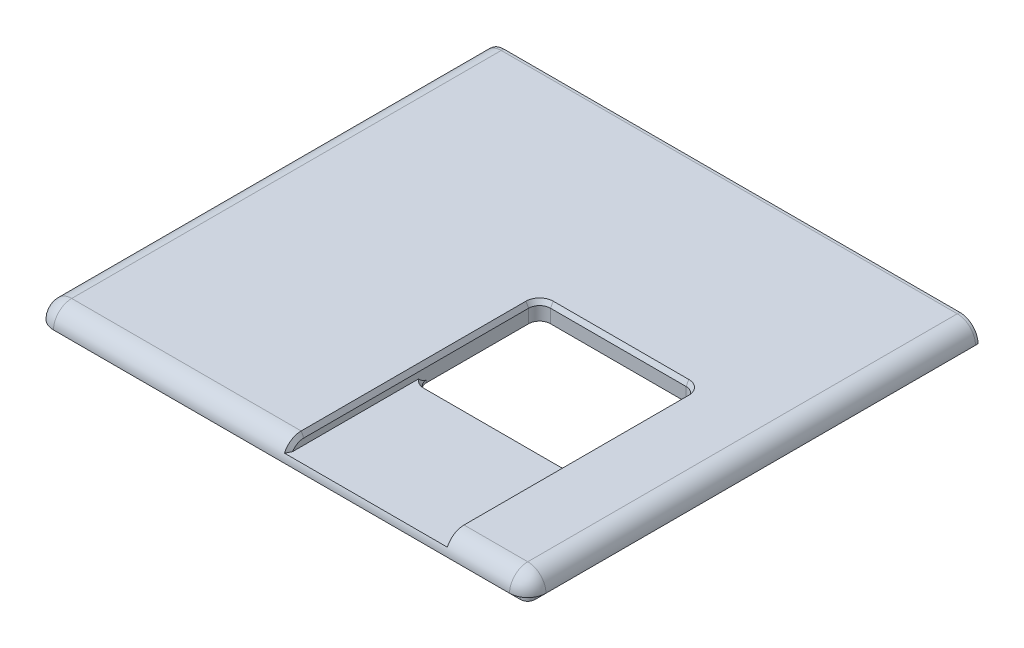
from build123d import *
from OCP.BRepFilletAPI import BRepFilletAPI_MakeChamfer

# Parameters (mm, degrees)
SKETCH1_W           = 135.29
SKETCH1_H           = 128
BOSS_EXTRUDE1_DEPTH = 5
SKETCH2_W           = 129.29
SKETCH2_H           = 122
BOSS_EXTRUDE2_DEPTH = 3
FILLET4_R           = 5
FILLET5_R           = 5
FILLET6_R           = 2
CUT_EXTRUDE1_REACH  = 95.466
SKETCH3_W           = 135.29
SKETCH3_H           = 4.25
SKETCH4_W           = 123.29
SKETCH4_H           = 117.75
CUT_EXTRUDE2_DEPTH  = 3
FILLET7_R           = 2
SKETCH5_W           = 43.25
SKETCH5_H           = 69.75
CUT_EXTRUDE3_DEPTH  = 3
SKETCH6_W           = 43.25
SKETCH6_H           = 34
CUT_EXTRUDE4_DEPTH  = 2
FILLET9_R           = 3
CHAMFER1_SIZE       = 0.75
CHAMFER1_SIZE2      = 1.299038106
CHAMFER2_SIZE       = 0.75
CHAMFER2_SIZE_2     = 1.299038106
SKETCH7_W           = 26
SKETCH7_H           = 3
CUT_EXTRUDE5_DEPTH  = 3
CHAMFER3_SIZE       = 0.75
CHAMFER3_SIZE2      = 1.299038106


# Some blends are built 0.0001 mm under size
with BuildPart() as part:
    # Sketch1 → Boss-Extrude1 (new body)
    with BuildSketch(Plane(origin=(0, 0, 0), x_dir=(1, 0, 0), z_dir=(0, 1, 0))):
        Rectangle(SKETCH1_W, SKETCH1_H)
    extrude(amount=BOSS_EXTRUDE1_DEPTH)

    # Sketch2 → Boss-Extrude2 (add)
    with BuildSketch(Plane.XZ):
        Rectangle(SKETCH2_W, SKETCH2_H)
    extrude(amount=BOSS_EXTRUDE2_DEPTH)

    # Fillet4
    fillet4_edges = [part.edges().sort_by_distance(p)[0] for p in [
        (-67.645, 2.5, -64),
        (67.645, 2.5, -64),
        (67.645, 2.5, 64),
        (-67.645, 2.5, 64),
    ]]
    fillet(fillet4_edges, radius=FILLET4_R)

    # Fillet5
    fillet5_edges = [part.edges().sort_by_distance(p)[0] for p in [
        (-66.180533906, 5, -62.535533906),
        (-67.645, 5, 0),
        (-66.180533906, 5, 62.535533906),
        (0, 5, 64),
        (66.180533906, 5, 62.535533906),
        (67.645, 5, 0),
        (66.180533906, 5, -62.535533906),
        (0, 5, -64),
    ]]
    fillet(fillet5_edges, radius=FILLET5_R - 0.0001)  # a hair under: the kernel refuses the full size

    # Fillet6
    fillet6_edges = [part.edges().sort_by_distance(p)[0] for p in [
        (-64.645, -1.5, 61),
        (-64.645, -1.5, -61),
        (64.645, -1.5, -61),
        (64.645, -1.5, 61),
    ]]
    fillet(fillet6_edges, radius=FILLET6_R)

    # Cut-Extrude1: up to this face of the body (flat: up to its plane)
    cut_extrude1_end = Plane(part.part.faces().sort_by_distance((0, -3, 0))[0])
    # Sketch3 → Cut-Extrude1 (cut, up to the picked face)
    with BuildSketch(Plane(origin=(0, 5, 0), x_dir=(1, 0, 0), z_dir=(0, 1, 0)), mode=Mode.PRIVATE) as cut_extrude1_sk1:
        with Locations((0, 61.875)):
            Rectangle(SKETCH3_W, SKETCH3_H)
    cut_extrude1_tool1 = split(extrude(cut_extrude1_sk1.sketch, amount=-CUT_EXTRUDE1_REACH, mode=Mode.PRIVATE), bisect_by=cut_extrude1_end, keep=Keep.BOTH, mode=Mode.PRIVATE)
    add(cut_extrude1_tool1.solids().sort_by(Axis((0, 5, -61.875), (0, -1, 0)))[0], mode=Mode.SUBTRACT)

    # Sketch4 → Cut-Extrude2 (cut)
    with BuildSketch(Plane.XZ.offset(3)):
        with Locations((0, -0.875)):
            Rectangle(SKETCH4_W, SKETCH4_H)
    extrude(amount=-CUT_EXTRUDE2_DEPTH, mode=Mode.SUBTRACT)

    # Fillet7
    fillet7_edges = [part.edges().sort_by_distance(p)[0] for p in [
        (-61.645, -1.5, 58),
        (61.645, -1.5, 58),
    ]]
    fillet(fillet7_edges, radius=FILLET7_R)

    # Sketch5 → Cut-Extrude3 (cut)
    with BuildSketch(Plane(origin=(0, 5, 0), x_dir=(1, 0, 0), z_dir=(0, 1, 0))):
        with Locations((22.77, -29.125)):
            Rectangle(SKETCH5_W, SKETCH5_H)
    extrude(amount=-CUT_EXTRUDE3_DEPTH, mode=Mode.SUBTRACT)

    # Sketch6 → Cut-Extrude4 (cut)
    with BuildSketch(Plane(origin=(0, 2, 0), x_dir=(1, 0, 0), z_dir=(0, 1, 0))):
        with Locations((22.77, -11.25)):
            Rectangle(SKETCH6_W, SKETCH6_H)
    extrude(amount=-CUT_EXTRUDE4_DEPTH, mode=Mode.SUBTRACT)

    # Fillet9
    fillet9_edges = [part.edges().sort_by_distance(p)[0] for p in [
        (1.145, 2.5, -5.75),
        (44.395, 2.5, -5.75),
        (44.395, 1, 28.25),
        (1.145, 1, 28.25),
    ]]
    fillet(fillet9_edges, radius=FILLET9_R)

    # Chamfer1: one chamfer whose edges measure the first distance from different faces: ONE call of the kernel's chamfer builder (chamfer() names one face for all edges)
    chamfer1_edges_1 = [part.edges().sort_by_distance(p)[0] for p in [
        (44.395, 4.183298538, 61.738685401),
        (1.145, 4.183298538, 61.738685401),
    ]]
    chamfer1_side_1 = [part.faces().sort_by_distance(p)[0] for p in [
        (0, 3.535563195, 62.535563195),
    ]]
    chamfer1_edges_2 = [part.edges().sort_by_distance(p)[0] for p in [
        (44.395, 5, 28.12505),
        (1.145, 5, 28.12505),
        (22.77, 5, -5.75),
        (43.516320344, 5, -4.871320344),
        (2.023679656, 5, -4.871320344),
    ]]
    chamfer1_side_2 = [part.faces().sort_by_distance(p)[0] for p in [
        (-5.311957969, 5, -6.221509605),
    ]]
    chamfer1 = BRepFilletAPI_MakeChamfer(part.part.solid().wrapped)
    for e in chamfer1_edges_1:
        chamfer1.Add(CHAMFER1_SIZE, CHAMFER1_SIZE2, e.wrapped, chamfer1_side_1[0].wrapped)  # the first distance lies on this face
    for e in chamfer1_edges_2:
        chamfer1.Add(CHAMFER1_SIZE, CHAMFER1_SIZE2, e.wrapped, chamfer1_side_2[0].wrapped)  # the first distance lies on this face
    add(Compound.cast(chamfer1.Shape()), mode=Mode.REPLACE)

    # Chamfer2
    # the kernel refuses this chamfer: 1.299038106, 0.75 mm, written as the material it takes off along each edge
    with BuildSketch(Plane(origin=(41.395, 2, 28.25), x_dir=(0, 0.05789386240267144, 0.9983227437537926), z_dir=(-1, 0, 0))) as chamfer2_piece_1:
        Polygon((CHAMFER2_SIZE * 0.998322743754, -CHAMFER2_SIZE * 0.0578938624027), (-CHAMFER2_SIZE_2 * 0.0578938623883, -CHAMFER2_SIZE_2 * 0.998322743505), (0, 0), align=None)
    extrude(amount=37.25, mode=Mode.SUBTRACT)
    with BuildSketch(Plane(origin=(4.145, 2, 25.25), x_dir=(-0.43506037057501545, 0, -0.9004012849586179), z_dir=(0.9004012849586179, 0, -0.43506037057501545))) as chamfer2_piece_2_section:
        Polygon((3 + CHAMFER2_SIZE, 0), (3, -CHAMFER2_SIZE_2), (3, 0), align=None)
    chamfer2_piece_2 = revolve(axis=Axis((4.145, 2, 25.25), (0, 1, 0)), revolution_arc=154.210864587, mode=Mode.PRIVATE)
    chamfer2_piece_2 = split(chamfer2_piece_2, bisect_by=Plane(origin=(1.145, 1.523753347, 27.427166172), z_dir=(1, 0, 0)), keep=Keep.TOP, mode=Mode.PRIVATE)
    add(chamfer2_piece_2, mode=Mode.SUBTRACT)
    with BuildSketch(Plane(origin=(41.395, 2, 25.25), x_dir=(0, 0, 1), z_dir=(-1, 0, 0))) as chamfer2_piece_3_section:
        Polygon((3 + CHAMFER2_SIZE, 0), (3, -CHAMFER2_SIZE_2), (3, 0), align=None)
    chamfer2_piece_3 = revolve(axis=Axis((41.395, 2, 25.25), (0, 1, 0)), revolution_arc=154.210864587, mode=Mode.PRIVATE)
    chamfer2_piece_3 = split(chamfer2_piece_3, bisect_by=Plane(origin=(44.395, 1.633451558, 28.466921633), z_dir=(-1, 0, 0)), keep=Keep.TOP, mode=Mode.PRIVATE)
    add(chamfer2_piece_3, mode=Mode.SUBTRACT)

    # Sketch7 → Cut-Extrude5 (cut)
    with BuildSketch(Plane(origin=(64.645, 0, 0), x_dir=(0, 0, -1), z_dir=(1, 0, 0))):
        with Locations((19, -1.5)):
            Rectangle(SKETCH7_W, SKETCH7_H)
    extrude(amount=-CUT_EXTRUDE5_DEPTH, mode=Mode.SUBTRACT)

    # Chamfer3: one chamfer whose edges measure the first distance from different faces: ONE call of the kernel's chamfer builder (chamfer() names one face for all edges)
    chamfer3_edges_1 = [part.edges().sort_by_distance(p)[0] for p in [
        (64.645, -1.5, -6),
    ]]
    chamfer3_side_1 = [part.faces().sort_by_distance(p)[0] for p in [
        (64.645, -1.5, 26.5),
    ]]
    chamfer3_edges_2 = [part.edges().sort_by_distance(p)[0] for p in [
        (64.645, -1.5, -32),
    ]]
    chamfer3_side_2 = [part.faces().sort_by_distance(p)[0] for p in [
        (64.645, -1.5, -45.5),
    ]]
    chamfer3 = BRepFilletAPI_MakeChamfer(part.part.solid().wrapped)
    for e in chamfer3_edges_1:
        chamfer3.Add(CHAMFER3_SIZE, CHAMFER3_SIZE2, e.wrapped, chamfer3_side_1[0].wrapped)  # the first distance lies on this face
    for e in chamfer3_edges_2:
        chamfer3.Add(CHAMFER3_SIZE, CHAMFER3_SIZE2, e.wrapped, chamfer3_side_2[0].wrapped)  # the first distance lies on this face
    add(Compound.cast(chamfer3.Shape()), mode=Mode.REPLACE)


solid = part.part
